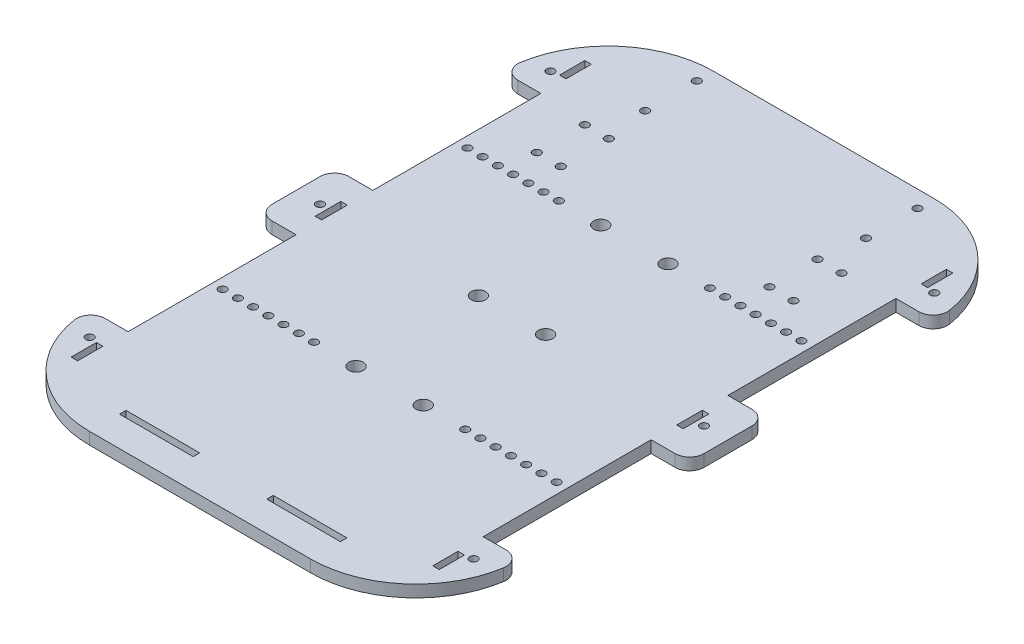
from build123d import *

# Parameters (mm, degrees)
SKETCH2_W           = 2.7
SKETCH2_H           = 10.51
SKETCH2_H_2         = 10.666666666
SKETCH2_W_2         = 30.68
SKETCH2_H_3         = 2.7
BOSS_EXTRUDE4_DEPTH = 5
SKETCH5_R           = 1.65
SKETCH5_R_2         = 3
CUT_EXTRUDE1_DEPTH  = 159.192920196


with BuildPart() as part:
    # Sketch2 → Boss-Extrude4 (new body)
    with BuildSketch(Plane(origin=(0, 0, 0), x_dir=(1, 0, 0), z_dir=(0, 1, 0))):
        with BuildLine():
            Line((46, -130), (-46, -130))
            ThreePointArc((-46, -130), (-74.550970119, -119.478980051), (-89.448061775, -92.947368421))
            ThreePointArc((-89.448061775, -92.947368421), (-88.08864154, -88.106685893), (-83.523326079, -86))
            Line((-83.523326079, -86), (-74, -86))
            Line((-74, -86), (-74, -16))
            Line((-74, -16), (-84, -16))
            ThreePointArc((-84, -16), (-88.242640687, -14.242640687), (-90, -10))
            Line((-90, -10), (-90, 10))
            ThreePointArc((-90, 10), (-88.242640687, 14.242640687), (-84, 16))
            Line((-84, 16), (-74, 16))
            Line((-74, 16), (-74, 86))
            Line((-74, 86), (-83.523326079, 86))
            ThreePointArc((-83.523326079, 86), (-88.08864154, 88.106685893), (-89.448061775, 92.947368421))
            ThreePointArc((-89.448061775, 92.947368421), (-74.550970119, 119.478980051), (-46, 130))
            Line((-46, 130), (46, 130))
            ThreePointArc((46, 130), (74.550970119, 119.478980051), (89.448061775, 92.947368421))
            ThreePointArc((89.448061775, 92.947368421), (88.08864154, 88.106685893), (83.523326079, 86))
            Line((83.523326079, 86), (74, 86))
            Line((74, 86), (74, 16))
            Line((74, 16), (84, 16))
            ThreePointArc((84, 16), (88.242640687, 14.242640687), (90, 10))
            Line((90, 10), (90, -10))
            ThreePointArc((90, -10), (88.242640687, -14.242640687), (84, -16))
            Line((84, -16), (74, -16))
            Line((74, -16), (74, -86))
            Line((74, -86), (83.523326079, -86))
            ThreePointArc((83.523326079, -86), (88.08864154, -88.106685893), (89.448061775, -92.947368421))
            ThreePointArc((89.448061775, -92.947368421), (74.550970119, -119.478980051), (46, -130))
        make_face()
        with Locations((-75.35, 101.765)):
            Rectangle(SKETCH2_W, SKETCH2_H, mode=Mode.SUBTRACT)
        with Locations((75.35, 101.765)):
            Rectangle(SKETCH2_W, SKETCH2_H, mode=Mode.SUBTRACT)
        with Locations((75.35, -101.765)):
            Rectangle(SKETCH2_W, SKETCH2_H, mode=Mode.SUBTRACT)
        with Locations((-75.35, -101.765)):
            Rectangle(SKETCH2_W, SKETCH2_H, mode=Mode.SUBTRACT)
        with Locations((-75.35, 0)):
            Rectangle(SKETCH2_W, SKETCH2_H_2, mode=Mode.SUBTRACT)
        with Locations((75.35, 0)):
            Rectangle(SKETCH2_W, SKETCH2_H_2, mode=Mode.SUBTRACT)
        with Locations((30.68, -116.18)):
            Rectangle(SKETCH2_W_2, SKETCH2_H_3, mode=Mode.SUBTRACT)
        with Locations((-30.68, -116.18)):
            Rectangle(SKETCH2_W_2, SKETCH2_H_3, mode=Mode.SUBTRACT)
    extrude(amount=BOSS_EXTRUDE4_DEPTH)

    # Sketch5 → Cut-Extrude1 (cut, through all)
    with BuildSketch(Plane(origin=(0, 5, 0), x_dir=(1, 0, 0), z_dir=(0, 1, 0))):
        with Locations((-69.6, -51)):
            Circle(SKETCH5_R)
        with Locations((-63.25, -51)):
            Circle(SKETCH5_R)
        with Locations((-56.9, -51)):
            Circle(SKETCH5_R)
        with Locations((-50.55, -51)):
            Circle(SKETCH5_R)
        with Locations((-44.2, -51)):
            Circle(SKETCH5_R)
        with Locations((-37.85, -51)):
            Circle(SKETCH5_R)
        with Locations((-31.5, -51)):
            Circle(SKETCH5_R)
        with Locations((31.5, -51)):
            Circle(SKETCH5_R)
        with Locations((37.85, -51)):
            Circle(SKETCH5_R)
        with Locations((44.2, -51)):
            Circle(SKETCH5_R)
        with Locations((50.55, -51)):
            Circle(SKETCH5_R)
        with Locations((56.9, -51)):
            Circle(SKETCH5_R)
        with Locations((63.25, -51)):
            Circle(SKETCH5_R)
        with Locations((69.6, -51)):
            Circle(SKETCH5_R)
        with Locations((69.6, 51)):
            Circle(SKETCH5_R)
        with Locations((63.25, 51)):
            Circle(SKETCH5_R)
        with Locations((56.9, 51)):
            Circle(SKETCH5_R)
        with Locations((50.55, 51)):
            Circle(SKETCH5_R)
        with Locations((44.2, 51)):
            Circle(SKETCH5_R)
        with Locations((37.85, 51)):
            Circle(SKETCH5_R)
        with Locations((31.5, 51)):
            Circle(SKETCH5_R)
        with Locations((-31.5, 51)):
            Circle(SKETCH5_R)
        with Locations((-37.85, 51)):
            Circle(SKETCH5_R)
        with Locations((-44.2, 51)):
            Circle(SKETCH5_R)
        with Locations((-50.55, 51)):
            Circle(SKETCH5_R)
        with Locations((-56.9, 51)):
            Circle(SKETCH5_R)
        with Locations((-63.25, 51)):
            Circle(SKETCH5_R)
        with Locations((-69.6, 51)):
            Circle(SKETCH5_R)
        with Locations((-14, -51)):
            Circle(SKETCH5_R_2)
        with Locations((14, -51)):
            Circle(SKETCH5_R_2)
        with Locations((14, 51)):
            Circle(SKETCH5_R_2)
        with Locations((-14, 51)):
            Circle(SKETCH5_R_2)
        with Locations((-14, 0)):
            Circle(SKETCH5_R_2)
        with Locations((14, 0)):
            Circle(SKETCH5_R_2)
        with Locations((-80, 96)):
            Circle(SKETCH5_R)
        with Locations((-80, 0)):
            Circle(SKETCH5_R)
        with Locations((80, 0)):
            Circle(SKETCH5_R)
        with Locations((-80, -96)):
            Circle(SKETCH5_R)
        with Locations((80, -96)):
            Circle(SKETCH5_R)
        with Locations((80, 96)):
            Circle(SKETCH5_R)
        with Locations((-53.5, 83.83)):
            Circle(SKETCH5_R)
        with Locations((-53.5, 63.83)):
            Circle(SKETCH5_R)
        with Locations((-43.5, 63.83)):
            Circle(SKETCH5_R)
        with Locations((-43.5, 83.83)):
            Circle(SKETCH5_R)
        with Locations((43.5, 63.83)):
            Circle(SKETCH5_R)
        with Locations((53.5, 63.83)):
            Circle(SKETCH5_R)
        with Locations((43.5, 83.83)):
            Circle(SKETCH5_R)
        with Locations((53.5, 83.83)):
            Circle(SKETCH5_R)
        with Locations((-46, 123)):
            Circle(SKETCH5_R)
        with Locations((-46, 101.5)):
            Circle(SKETCH5_R)
        with Locations((46, 101.5)):
            Circle(SKETCH5_R)
        with Locations((46, 123)):
            Circle(SKETCH5_R)
    extrude(amount=-CUT_EXTRUDE1_DEPTH, mode=Mode.SUBTRACT)


solid = part.part
